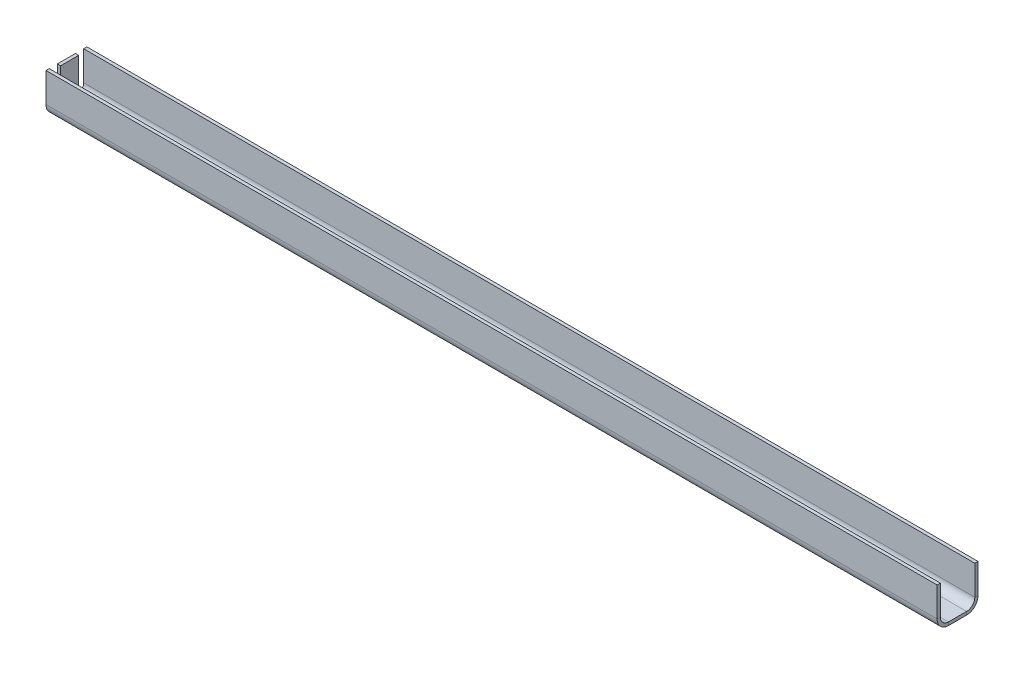
from build123d import *

# Parameters (mm, degrees)
SKETCH10_W                   = 276.86
SKETCH10_H                   = 12.7
BASE_FLANGE1_DEPTH           = 1
EDGE_FLANGE1_STRIP_W         = 9.08
EDGE_FLANGE1_STRIP_H         = 1
EDGE_FLANGE1_STRIP_CUT_DEPTH = 276.86
EDGE_FLANGE1_DEPTH           = 276.86
EDGE_FLANGE2_STRIP_W         = 9.08
EDGE_FLANGE2_STRIP_H         = 1
EDGE_FLANGE2_STRIP_CUT_DEPTH = 276.86
EDGE_FLANGE2_DEPTH           = 276.86
EDGE_FLANGE3_STRIP_W         = 9.08
EDGE_FLANGE3_STRIP_H         = 1
EDGE_FLANGE3_STRIP_CUT_DEPTH = 5.62
EDGE_FLANGE3_DEPTH           = 5.62


# Sheet-metal steps are written as plain solids
with BuildPart() as part:
    # Sketch10 → Base-Flange1 (new body)
    with BuildSketch(Plane(origin=(0, 0, 0), x_dir=(1, 0, 0), z_dir=(0, 1, 0))):
        Rectangle(SKETCH10_W, SKETCH10_H)
    extrude(amount=-BASE_FLANGE1_DEPTH)

    # Edge-Flange1 strip (across the edge) → Edge-Flange1 strip cut (cut)
    with BuildSketch(Plane(origin=(138.43, 0, -6.35), x_dir=(0, 0, 1), z_dir=(-1, 0, 0))):
        with Locations((-1, -0.5)):
            Rectangle(EDGE_FLANGE1_STRIP_W, EDGE_FLANGE1_STRIP_H)
    extrude(amount=EDGE_FLANGE1_STRIP_CUT_DEPTH, mode=Mode.SUBTRACT)

    # Edge-Flange1 section (across the edge) → Edge-Flange1 (add)
    with BuildSketch(Plane(origin=(138.43, 0, -6.35), x_dir=(0, 0, 1), z_dir=(-1, 0, 0))):
        with BuildLine():
            Line((0, 2.54), (0, 11.7))
            Line((0, 11.7), (1, 11.7))
            Line((1, 11.7), (1, 2.54))
            ThreePointArc((1, 2.54), (1.743948776, 0.743948776), (3.54, 0))
            Line((3.54, 0), (3.54, -1))
            ThreePointArc((3.54, -1), (1.036841995, 0.036841995), (0, 2.54))
        make_face()
    extrude(amount=EDGE_FLANGE1_DEPTH)

    # Edge-Flange2 strip (across the edge) → Edge-Flange2 strip cut (cut)
    with BuildSketch(Plane(origin=(-138.43, 0, 6.35), x_dir=(0, 0, -1), z_dir=(1, 0, 0))):
        with Locations((-1, -0.5)):
            Rectangle(EDGE_FLANGE2_STRIP_W, EDGE_FLANGE2_STRIP_H)
    extrude(amount=EDGE_FLANGE2_STRIP_CUT_DEPTH, mode=Mode.SUBTRACT)

    # Edge-Flange2 section (across the edge) → Edge-Flange2 (add)
    with BuildSketch(Plane(origin=(-138.43, 0, 6.35), x_dir=(0, 0, -1), z_dir=(1, 0, 0))):
        with BuildLine():
            Line((0, 2.54), (0, 11.7))
            Line((0, 11.7), (1, 11.7))
            Line((1, 11.7), (1, 2.54))
            ThreePointArc((1, 2.54), (1.743948776, 0.743948776), (3.54, 0))
            Line((3.54, 0), (3.54, -1))
            ThreePointArc((3.54, -1), (1.036841995, 0.036841995), (0, 2.54))
        make_face()
    extrude(amount=EDGE_FLANGE2_DEPTH)

    # Edge-Flange3 strip (across the edge) → Edge-Flange3 strip cut (cut)
    with BuildSketch(Plane(origin=(-138.43, 0, -2.81), x_dir=(1, 0, 0), z_dir=(0, 0, 1))):
        with Locations((-1, -0.5)):
            Rectangle(EDGE_FLANGE3_STRIP_W, EDGE_FLANGE3_STRIP_H)
    extrude(amount=EDGE_FLANGE3_STRIP_CUT_DEPTH, mode=Mode.SUBTRACT)

    # Edge-Flange3 section (across the edge) → Edge-Flange3 (add)
    with BuildSketch(Plane(origin=(-138.43, 0, -2.81), x_dir=(1, 0, 0), z_dir=(0, 0, 1))):
        with BuildLine():
            Line((0, 2.54), (0, 11.7))
            Line((0, 11.7), (1, 11.7))
            Line((1, 11.7), (1, 2.54))
            ThreePointArc((1, 2.54), (1.743948776, 0.743948776), (3.54, 0))
            Line((3.54, 0), (3.54, -1))
            ThreePointArc((3.54, -1), (1.036841995, 0.036841995), (0, 2.54))
        make_face()
    extrude(amount=EDGE_FLANGE3_DEPTH)


solid = part.part
